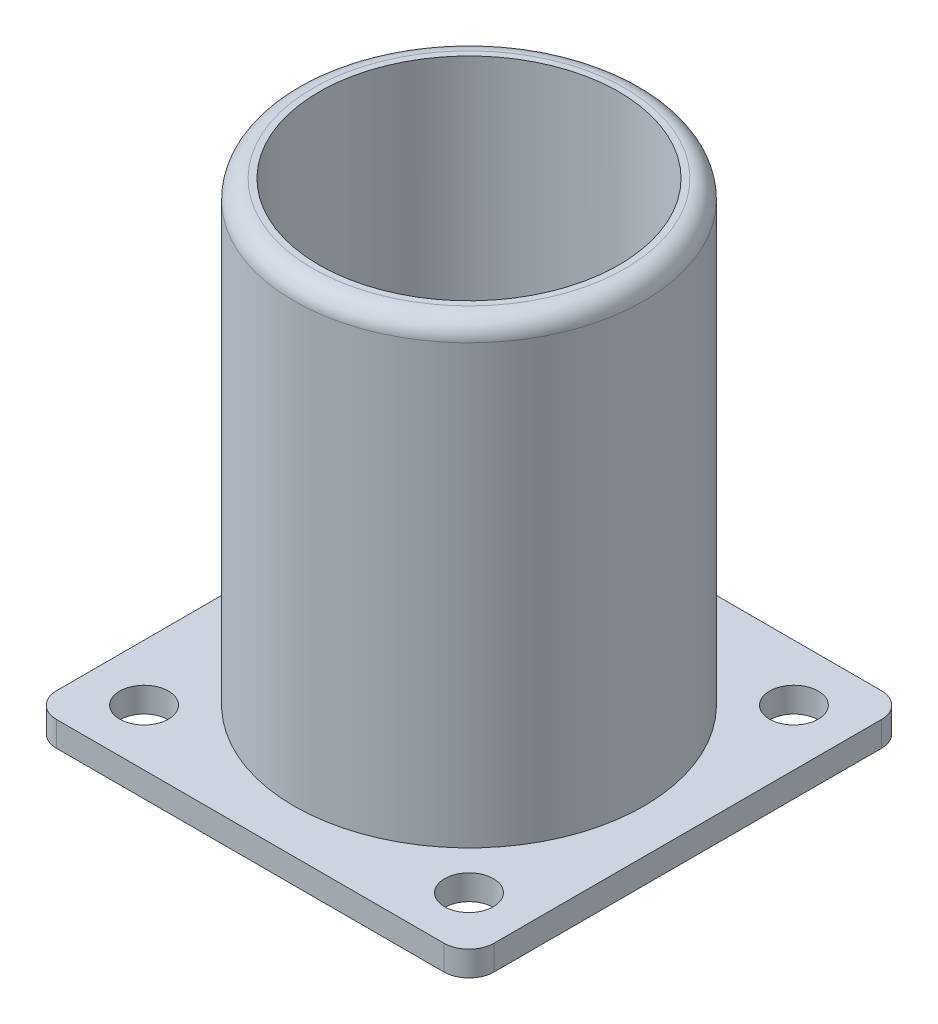
from build123d import *
from build123d.topology import SkipClean

# Parameters (mm, degrees)
ESBO_O1_W                = 35
ESBO_O1_H                = 35
ESBO_O1_R                = 1.95
RESSALTO_EXTRUS_O1_DEPTH = 2
FILETE2_R                = 2
ESBO_O3_R                = 14
ESBO_O3_R_2              = 12
RESSALTO_EXTRUS_O3_DEPTH = 36.5
FILETE3_R                = 1.5


with BuildPart() as part:
    # Esboço1 → Ressalto-extrusão1 (new body)
    with BuildSketch(Plane(origin=(0, 0, 0), x_dir=(1, 0, 0), z_dir=(0, 1, 0))):
        Rectangle(ESBO_O1_W, ESBO_O1_H)
        with Locations((-13, -13)):
            Circle(ESBO_O1_R, mode=Mode.SUBTRACT)
        with Locations((13, -13)):
            Circle(ESBO_O1_R, mode=Mode.SUBTRACT)
        with BuildLine():
            ThreePointArc((-9.75, -6.99553429), (-10.59422921, -5.635805838), (-11.25, -4.175823272))
            Line((-11.25, -4.175823272), (-11.25, 4.175823272))
            ThreePointArc((-11.25, 4.175823272), (-10.59422921, 5.635805838), (-9.75, 6.99553429))
            Line((-9.75, 6.99553429), (-9.75, -6.99553429))
        make_face(mode=Mode.SUBTRACT)
        with BuildLine():
            ThreePointArc((-6.75, -9.921567416), (-7.524255874, -9.348025115), (-8.25, -8.714212529))
            Line((-8.25, -8.714212529), (-8.25, 8.714212529))
            ThreePointArc((-8.25, 8.714212529), (-7.524255874, 9.348025115), (-6.75, 9.921567416))
            Line((-6.75, 9.921567416), (-6.75, -9.921567416))
        make_face(mode=Mode.SUBTRACT)
        with BuildLine():
            ThreePointArc((-3.75, -11.399013115), (-4.510269977, -11.120137802), (-5.25, -10.790620927))
            Line((-5.25, -10.790620927), (-5.25, 10.790620927))
            ThreePointArc((-5.25, 10.790620927), (-4.510269977, 11.120137802), (-3.75, 11.399013115))
            Line((-3.75, 11.399013115), (-3.75, -11.399013115))
        make_face(mode=Mode.SUBTRACT)
        with BuildLine():
            Line((-0.75, 11.976539567), (-0.75, -11.976539567))
            ThreePointArc((-0.75, -11.976539567), (-1.502985267, -11.905504411), (-2.25, -11.787175234))
            Line((-2.25, -11.787175234), (-2.25, 11.787175234))
            ThreePointArc((-2.25, 11.787175234), (-1.502985267, 11.905504411), (-0.75, 11.976539567))
        make_face(mode=Mode.SUBTRACT)
        with Locations((-13, 13)):
            Circle(ESBO_O1_R, mode=Mode.SUBTRACT)
        with BuildLine():
            ThreePointArc((2.25, -11.787175234), (1.502985267, -11.905504411), (0.75, -11.976539567))
            Line((0.75, -11.976539567), (0.75, 11.976539567))
            ThreePointArc((0.75, 11.976539567), (1.502985267, 11.905504411), (2.25, 11.787175234))
            Line((2.25, 11.787175234), (2.25, -11.787175234))
        make_face(mode=Mode.SUBTRACT)
        with BuildLine():
            ThreePointArc((5.25, -10.790620927), (4.510269977, -11.120137802), (3.75, -11.399013115))
            Line((3.75, -11.399013115), (3.75, 11.399013115))
            ThreePointArc((3.75, 11.399013115), (4.510269977, 11.120137802), (5.25, 10.790620927))
            Line((5.25, 10.790620927), (5.25, -10.790620927))
        make_face(mode=Mode.SUBTRACT)
        with BuildLine():
            ThreePointArc((8.25, -8.714212529), (7.524255874, -9.348025115), (6.75, -9.921567416))
            Line((6.75, -9.921567416), (6.75, 9.921567416))
            ThreePointArc((6.75, 9.921567416), (7.524255874, 9.348025115), (8.25, 8.714212529))
            Line((8.25, 8.714212529), (8.25, -8.714212529))
        make_face(mode=Mode.SUBTRACT)
        with BuildLine():
            ThreePointArc((11.25, -4.175823272), (10.59422921, -5.635805838), (9.75, -6.99553429))
            Line((9.75, -6.99553429), (9.75, 6.99553429))
            ThreePointArc((9.75, 6.99553429), (10.59422921, 5.635805838), (11.25, 4.175823272))
            Line((11.25, 4.175823272), (11.25, -4.175823272))
        make_face(mode=Mode.SUBTRACT)
        with Locations((13, 13)):
            Circle(ESBO_O1_R, mode=Mode.SUBTRACT)
    extrude(amount=RESSALTO_EXTRUS_O1_DEPTH)

    # Filete2
    filete2_edges = [part.edges().sort_by_distance(p)[0] for p in [
        (-17.5, 1, 17.5),
        (17.5, 1, 17.5),
        (17.5, 1, -17.5),
        (-17.5, 1, -17.5),
    ]]
    fillet(filete2_edges, radius=FILETE2_R)

    # Esboço3 → Ressalto-extrusão3 (add)
    with SkipClean():  # the faces are left unmerged after this step: merging them gives an invalid solid
        with BuildSketch(Plane(origin=(0, 2, 0), x_dir=(1, 0, 0), z_dir=(0, 1, 0))):
            Circle(ESBO_O3_R)
            Circle(ESBO_O3_R_2, mode=Mode.SUBTRACT)
        extrude(amount=RESSALTO_EXTRUS_O3_DEPTH)

    # Filete3
    filete3_edges = [part.edges().sort_by_distance(p)[0] for p in [
        (-14, 38.5, 0),
    ]]
    fillet(filete3_edges, radius=FILETE3_R)


solid = part.part
